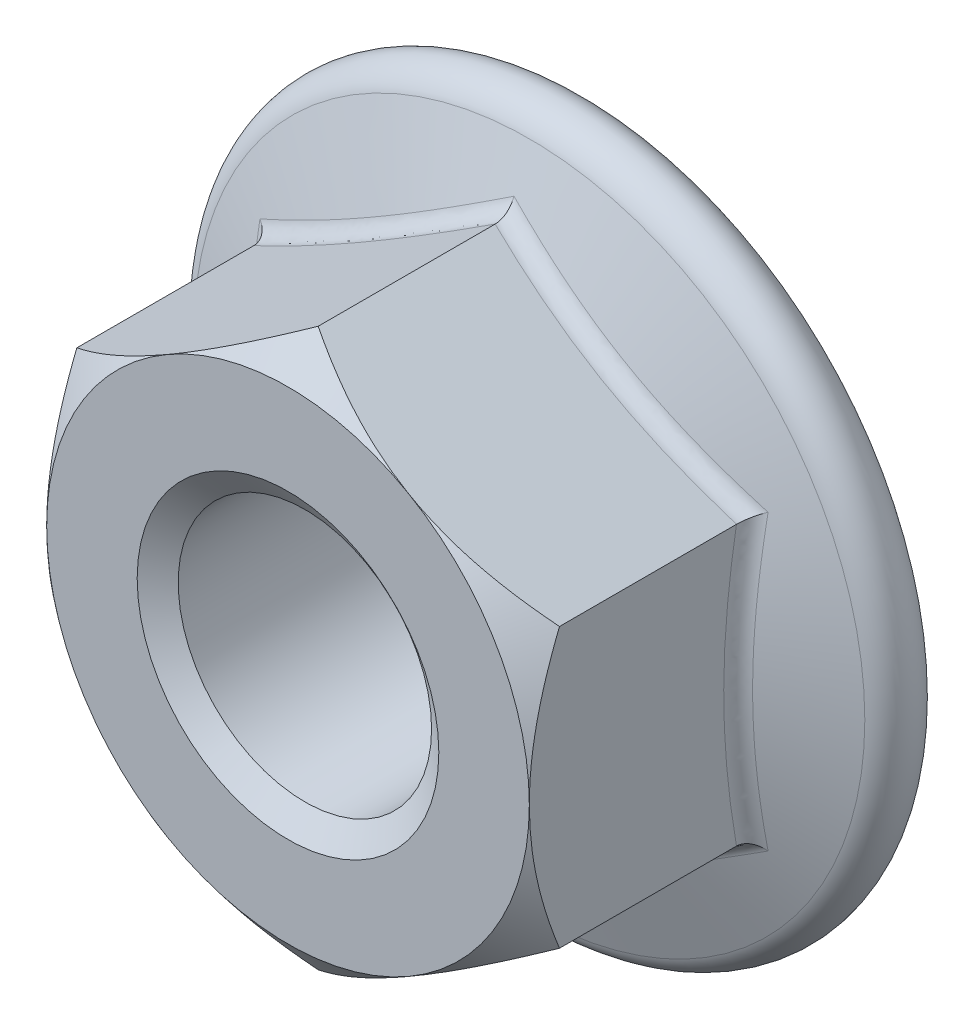
from build123d import *

# Parameters (mm, degrees)
BASENUT_START  = -5
BASENUTSKE_R   = 2.1
BASENUT_DEPTH  = 5
FLANGEFILLET_R = 0.3


# Read off the part's stored shape, not the designer's step: ThreadSchematic
with BuildPart() as part:
    # BaseNutSke → BaseNut (new body)
    with BuildSketch(Plane.XY.offset(BASENUT_START)):
        Polygon((4, 2.309401077), (4, -2.309401077), (0, -4.618802154), (-4, -2.309401077), (-4, 2.309401077), (0, 4.618802154), align=None)
        Circle(BASENUTSKE_R, mode=Mode.SUBTRACT)
    extrude(amount=BASENUT_DEPTH)

    # Sketch5 (on Right Plane) → EndChamfer (revolve, cut)
    with BuildSketch(Plane(origin=(0, 0, 0), x_dir=(0, 0, -1), z_dir=(1, 0, 0))):
        Polygon((4.9746, 2.5), (4.666508683, 2.06), (5.0254, 2.06), (5.0254, 2.5), align=None)
    revolve(axis=Axis((0, 2.06, -5.0254), (0, 0, 1)), mode=Mode.SUBTRACT)

    # Sketch6 → Flange (revolve)
    with BuildSketch(Plane(origin=(0, 0, 0), x_dir=(0, 0, -1), z_dir=(1, 0, 0)), mode=Mode.PRIVATE) as flange_sk:
        with BuildLine():
            Line((2.740378591, 2.1), (4, 5.560781379))
            ThreePointArc((4, 5.560781379), (4.573977952, 5.892167704), (5, 5.384454398))
            Line((5, 5.384454398), (5, 2.1))
            Line((5, 2.1), (2.740378591, 2.1))
        make_face()
    revolve(flange_sk.sketch.rotate(Axis((0, 0, 0), (0, 0, -1)), 90), axis=Axis((0, 0, 0), (0, 0, -1)))

    # Sketch3 → Double-Chamfer (revolve, cut)
    with BuildSketch(Plane(origin=(0, 0, 0), x_dir=(0, 0, -1), z_dir=(1, 0, 0)), mode=Mode.PRIVATE) as double_chamfer_sk:
        Polygon((0.5, 17.318802154), (-12.7, 17.318802154), (-12.7, 4), (0, 4), (0.5, 4.618802154), align=None)
    revolve(double_chamfer_sk.sketch.rotate(Axis((0, 0, 0), (0, 0, -1)), 90), axis=Axis((0, 0, 0), (0, 0, -1)), mode=Mode.SUBTRACT)

    # FlangeFillet
    flangefillet_edges = [part.edges().sort_by_distance(p)[0] for p in [
        (4, 1.159737717, -3.491879534),
        (2, 3.464101615, -3.431922036),
        (-2, 3.464101615, -3.431922036),
        (-4, 0, -3.431922036),
        (-2, -3.464101615, -3.431922036),
        (2, -3.464101615, -3.431922036),
        (4, -1.159737717, -3.491879534),
    ]]
    fillet(flangefillet_edges, radius=FLANGEFILLET_R)

    # ThreadSchematic outline → ThreadSchematic (revolve, cut)
    with BuildSketch(Plane.XZ):
        Polygon((2.1, 0), (2.1, -0.280083015), (2.5, 0), align=None)
        Polygon((2.5, -4.9746), (2.1, -4.694516985), (2.1, -5), (2.5, -5), align=None)
    revolve(axis=Axis((0, 0, 0), (0, 0, 1)), mode=Mode.SUBTRACT)


solid = part.part
